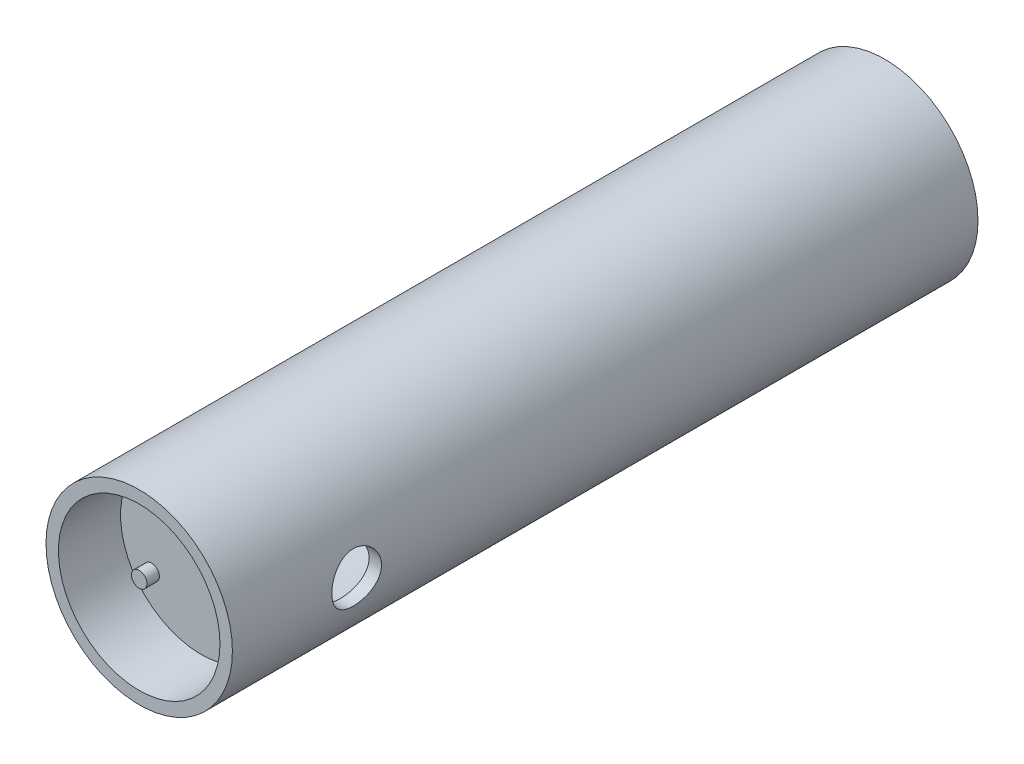
from build123d import *

# Parameters (mm, degrees)
ESBO_O1_W                  = 120
ESBO_O1_H                  = 15
ESBO_O2_R                  = 13
CORTE_EXTRUS_O1_DEPTH      = 122.86057607
ESBO_O3_R                  = 13
RESSALTO_EXTRUS_O1_DEPTH   = 5
ESBO_O4_R                  = 1.25
RESSALTO_EXTRUS_O2_DEPTH   = 2
CORTE_EXTRUS_O2_REACH      = 114.027
ESBO_O5_W                  = 20
ESBO_O5_H                  = 3
CORTE_EXTRUS_O3_DEPTH      = 64.639610307
CORTE_EXTRUS_O3_DEPTH_BACK = 64.639610307
ESBO_O6_R                  = 4


with BuildPart() as part:
    # Esboço1 → Revolução1 (revolve)
    with BuildSketch(Plane(origin=(0, 0, 0), x_dir=(0, 0, -1), z_dir=(1, 0, 0))):
        with Locations((0, 7.5)):
            Rectangle(ESBO_O1_W, ESBO_O1_H)
    revolve(axis=Axis((0, 0, 60), (0, 0, -1)))

    # Esboço2 → Corte-extrusão1 (cut, through all)
    with BuildSketch(Plane.XY.offset(60)):
        Circle(ESBO_O2_R)
    extrude(amount=-CORTE_EXTRUS_O1_DEPTH, mode=Mode.SUBTRACT)



with BuildPart() as body_2:
    # Esboço3 → Ressalto-extrusão1 (new body)
    with BuildSketch(Plane.XY.offset(50)):
        Circle(ESBO_O3_R)
    extrude(amount=-RESSALTO_EXTRUS_O1_DEPTH)


with BuildPart() as part_1:
    add(part.part)

    add(body_2.part)  # Ressalto-extrusão2 merges body 2
    # Esboço4 → Ressalto-extrusão2 (add)
    with BuildSketch(Plane.XY.offset(50)):
        with Locations((-8, -5.5)):
            Circle(ESBO_O4_R)
        with Locations((8, -5.5)):
            Circle(ESBO_O4_R)
    extrude(amount=RESSALTO_EXTRUS_O2_DEPTH)

    # Esboço5 → Corte-extrusão2 (cut, up to next)
    with BuildSketch(Plane.XY.offset(50), mode=Mode.PRIVATE) as corte_extrus_o2_sk1:
        with Locations((0, 6)):
            Rectangle(ESBO_O5_W, ESBO_O5_H)
    corte_extrus_o2_tool1 = extrude(corte_extrus_o2_sk1.sketch, amount=-CORTE_EXTRUS_O2_REACH, mode=Mode.PRIVATE) & part_1.part
    add(corte_extrus_o2_tool1.solids().sort_by_distance((0, 6, 50))[0], mode=Mode.SUBTRACT)

    # Esboço6 → Corte-extrusão3 (cut, two sides: drawn at the far end of the back side and taken through both)
    with BuildSketch(Plane(origin=(0, 0, 0), x_dir=(0, 0, -1), z_dir=(1, 0, 0)).offset(-CORTE_EXTRUS_O3_DEPTH_BACK)):
        with Locations((-40, 0)):
            Circle(ESBO_O6_R)
    extrude(amount=CORTE_EXTRUS_O3_DEPTH + CORTE_EXTRUS_O3_DEPTH_BACK, mode=Mode.SUBTRACT)


solid = part_1.part
